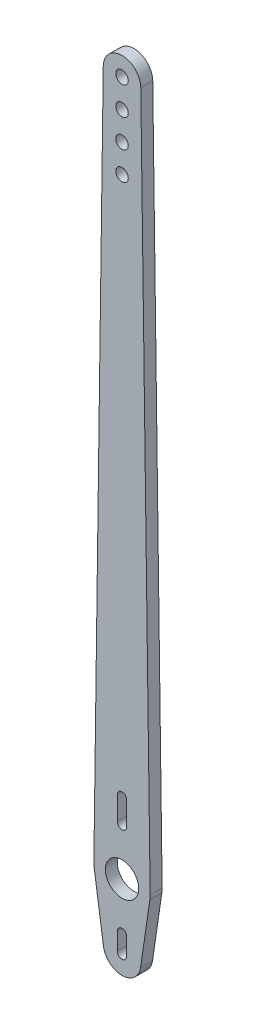
from build123d import *

# Parameters (mm, degrees)
MODEL_R             = 3.55
MODEL_R_2           = 1.33
BOSS_EXTRUDE1_DEPTH = 2.55


with BuildPart() as part:
    # Model → Boss-Extrude1 (new body)
    with BuildSketch(Plane.XY):
        with BuildLine():
            Line((3.957769087, -14.379710145), (5.936653631, -0.869565217))
            ThreePointArc((5.936653631, -0.869565217), (5.986951418, -0.395490482), (5.99945213, 0.081081081))
            Line((5.99945213, 0.081081081), (3.999634753, 148.054054054))
            ThreePointArc((3.999634753, 148.054054054), (0, 152), (-3.999634753, 148.054054054))
            Line((-3.999634753, 148.054054054), (-5.99945213, 0.081081081))
            ThreePointArc((-5.99945213, 0.081081081), (-5.986951418, -0.395490482), (-5.936653631, -0.869565217))
            Line((-5.936653631, -0.869565217), (-3.957769087, -14.379710145))
            ThreePointArc((-3.957769087, -14.379710145), (0, -17.8), (3.957769087, -14.379710145))
        make_face()
        Circle(MODEL_R, mode=Mode.SUBTRACT)
        with Locations((0, 148)):
            Circle(MODEL_R_2, mode=Mode.SUBTRACT)
        with Locations((0, 142)):
            Circle(MODEL_R_2, mode=Mode.SUBTRACT)
        with Locations((0, 136)):
            Circle(MODEL_R_2, mode=Mode.SUBTRACT)
        with Locations((0, 130)):
            Circle(MODEL_R_2, mode=Mode.SUBTRACT)
        with BuildLine():
            Line((-1, -10.1), (-1, -13.8))
            ThreePointArc((-1, -13.8), (0, -14.8), (1, -13.8))
            Line((1, -13.8), (1, -10.1))
            ThreePointArc((1, -10.1), (0, -9.1), (-1, -10.1))
        make_face(mode=Mode.SUBTRACT)
        with BuildLine():
            Line((-1, 15.1), (-1, 10.1))
            ThreePointArc((-1, 10.1), (0, 9.1), (1, 10.1))
            Line((1, 10.1), (1, 15.1))
            ThreePointArc((1, 15.1), (0, 16.1), (-1, 15.1))
        make_face(mode=Mode.SUBTRACT)
    extrude(amount=BOSS_EXTRUDE1_DEPTH)


solid = part.part
